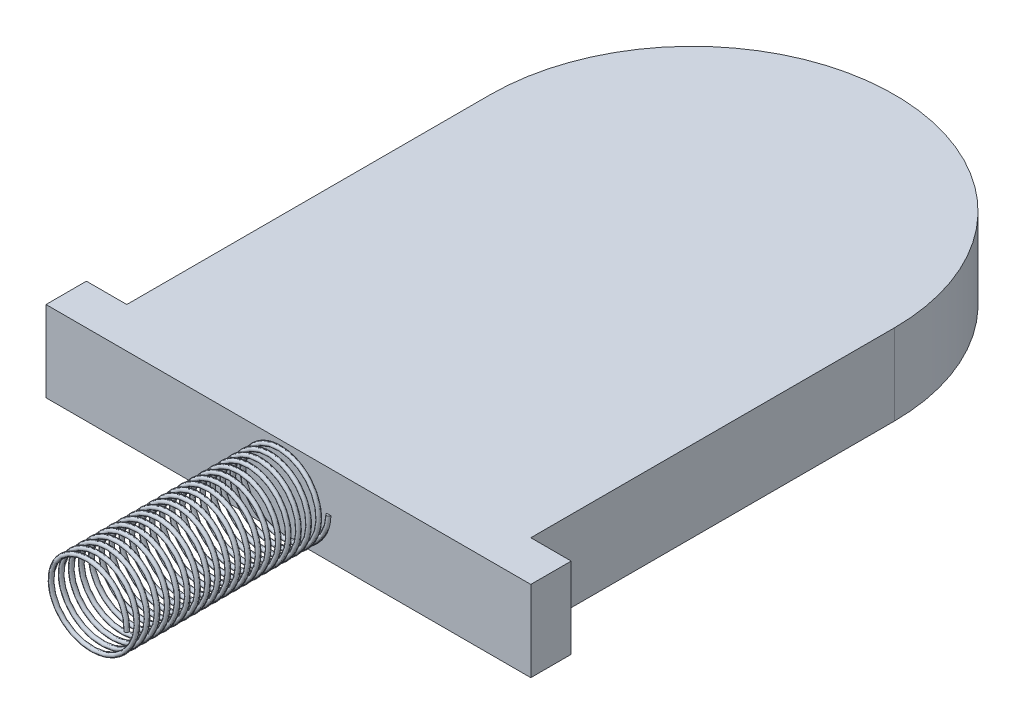
from build123d import *

# Parameters (mm, degrees)
SKETCH_1_W           = 2
SKETCH_1_H           = 2
EXTRUDE_1_DEPTH      = 0.4
SWEEP_1_PITCH        = 0.05
EXTRUDE_2_DEPTH      = 0.2
EXTRUDE_2_DEPTH_BACK = 2.2
SKETCH_5_W           = 0.2
SKETCH_5_H           = 0.4


with BuildPart() as part:
    # 草图1 → 凸台-拉伸1 (new body)
    with BuildSketch(Plane(origin=(0, 0, 0), x_dir=(1, 0, 0), z_dir=(0, 1, 0))):
        with BuildLine():
            ThreePointArc((-1, 1), (0, 2), (1, 1))
            Line((1, 1), (-1, 1))
        make_face()
        Rectangle(SKETCH_1_W, SKETCH_1_H)
    extrude(amount=EXTRUDE_1_DEPTH)

    # 扫描1: the profile of 草图4 screwed along a left-hand helix of 20 turns, 6 arcs to a turn; built about Z, then put on its axis
    sweep_1_z = Axis((0, 0, 0), (0, 0, 1))
    sweep_1_corners = [(0.19, 0, 0), (0.2, 0, 0.01), (0.21, 0, 0), (0.2, 0, -0.01)]
    with BuildLine(mode=Mode.PRIVATE) as sweep_1_profile:
        ThreePointArc((0.19, 0, 0), (0.192928932, 0, 0.007071068), (0.2, 0, 0.01))
        ThreePointArc((0.2, 0, 0.01), (0.207071068, 0, 0.007071068), (0.21, 0, 0))
        ThreePointArc((0.21, 0, 0), (0.207071068, 0, -0.007071068), (0.2, 0, -0.01))
        ThreePointArc((0.2, 0, -0.01), (0.192928932, 0, -0.007071068), (0.19, 0, 0))
    sweep_1_cap = Face(sweep_1_profile.wire())
    sweep_1_arcs = [((0.19, 0, 0), (0.19, 0, 0.01), (0.2, 0, 0.01), (1, 0.7071067811865476, 1)), ((0.2, 0, 0.01), (0.21, 0, 0.01), (0.21, 0, 0), (1, 0.7071067811865476, 1)), ((0.21, 0, 0), (0.21, 0, -0.01), (0.2, 0, -0.01), (1, 0.7071067811865476, 1)), ((0.2, 0, -0.01), (0.19, 0, -0.01), (0.19, 0, 0), (1, 0.7071067811865476, 1))]  # start, shoulder, end, weights
    sweep_1_turn_angles = [0, -30, -60, -90, -120, -150, -180, -210, -240, -270, -300, -330, -360]
    sweep_1_turn_weights = [1, 0.8660254037844387, 1, 0.8660254037844387, 1, 0.8660254037844387, 1, 0.8660254037844387, 1, 0.8660254037844387, 1, 0.8660254037844387, 1]
    sweep_1_turn_sides = [Face.make_bezier_surface([[Vector(p[j][0], p[j][1], 0).rotate(sweep_1_z, sweep_1_turn_angles[2 * i + k]) / sweep_1_turn_weights[2 * i + k] + Vector(0, 0, p[j][2] + -SWEEP_1_PITCH * sweep_1_turn_angles[2 * i + k] / 360) for k in range(3)] for j in range(3)], [[p[3][j] * sweep_1_turn_weights[2 * i + k] for k in range(3)] for j in range(3)]) for p in sweep_1_arcs for i in range(6)]
    sweep_1 = Plane(origin=(0, 0.2, 1), x_dir=(1, 0, 0), z_dir=(0, 0, 1)) * Solid(Shell([*[p.moved(Location((0, 0, SWEEP_1_PITCH * i))) for i in range(20) for p in sweep_1_turn_sides], sweep_1_cap, sweep_1_cap.rotate(sweep_1_z, -7200).moved(Location((0, 0, -SWEEP_1_PITCH * -7200 / 360)))]))
    add(sweep_1)

    # 草图5 → 凸台-拉伸2 (add, two sides: drawn at the far end of the back side and taken through both)
    with BuildSketch(Plane(origin=(1, 0, 0), x_dir=(0, 0, -1), z_dir=(1, 0, 0)).offset(-EXTRUDE_2_DEPTH_BACK)):
        with Locations((-0.9, 0.2)):
            Rectangle(SKETCH_5_W, SKETCH_5_H)
    extrude(amount=EXTRUDE_2_DEPTH + EXTRUDE_2_DEPTH_BACK)


solid = part.part
